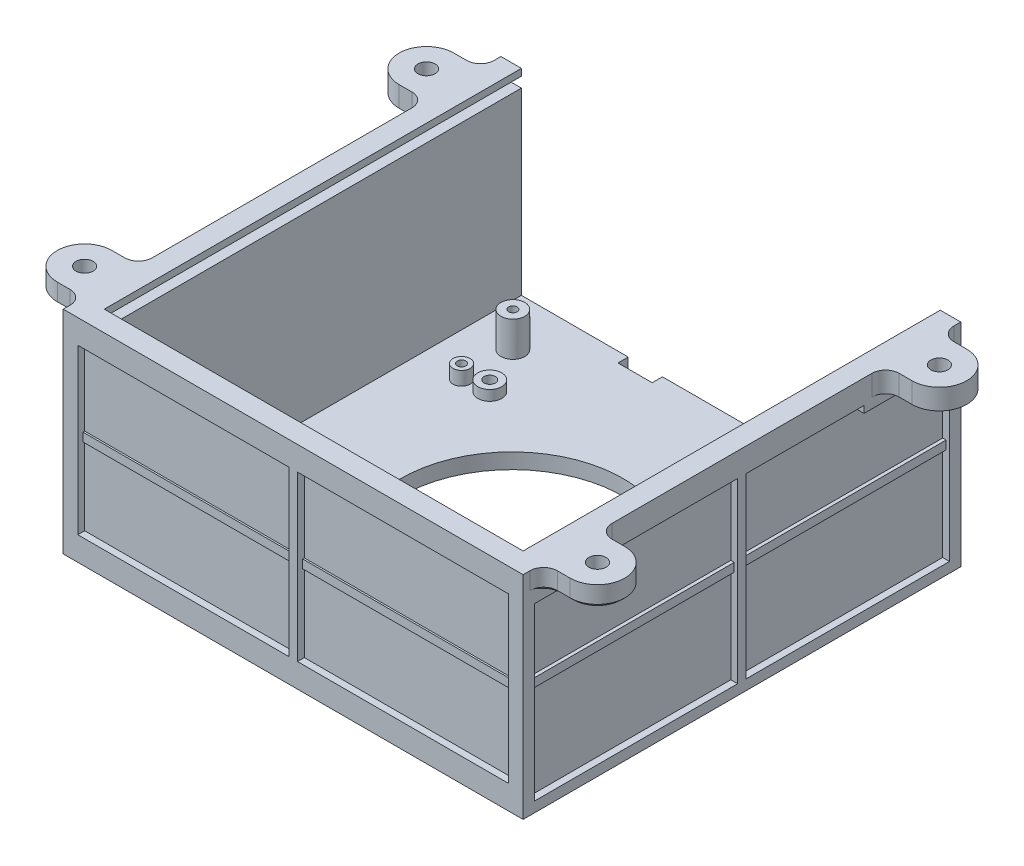
from build123d import *

# Parameters (mm, degrees)
EXTRUDE_2_DEPTH             = 2.5
EXTRUDE_2_DEPTH_BACK        = 2
SKETCH_1_W                  = 122.5
SKETCH_1_H                  = 128
SKETCH_1_R                  = 32.5
SKETCH_25_W                 = 6
SKETCH_25_H                 = 62
EXTRUDE_3_DEPTH             = 128
EXTRUDE_4_DEPTH             = 6
HOLE_WIZARD_M6_1_D          = 5
HOLE_WIZARD_M6_1_DEPTH      = 62
FILLET_3426_R               = 4
CHAMFER_5_SIZE              = 1
CUT_EXTRUDE_2_DEPTH         = 2
RIB_START                   = -1.25
RIB_21_OUTLINE_W            = 2
RIB_21_OUTLINE_H            = 52
RIB_21_DEPTH                = 2.5
RIB_19_OUTLINE_W            = 1
RIB_19_OUTLINE_H            = 59.462932812
RIB_19_DEPTH                = 2.5
MIRROR_START                = -1.25
MIRROR_24_COPY_1_SKETCH_W   = 1
MIRROR_24_COPY_1_SKETCH_H   = 59.462932812
MIRROR_24_COPY_1_DEPTH      = 2.5
SKETCH_93_R                 = 3.5
EXTRUDE_6713_DEPTH          = 10.2
SKETCH_97_R                 = 2.5
EXTRUDE_6822_DEPTH          = 4
SKETCH_101_W                = 1.25
SKETCH_101_H                = 10.2
HOLE_WIZARD_M3_5_AT_2_COUNT = 2
HOLE_WIZARD_M3_5_AT_2_PITCH = 75
HOLE_WIZARD_M3_5_AT_3_COUNT = 2
HOLE_WIZARD_M3_5_AT_3_PITCH = 15
HOLE_WIZARD_M3_5_AT_4_COUNT = 2
HOLE_WIZARD_M3_5_AT_4_PITCH = 81.39410298
HOLE_WIZARD_M3_5_AT_5_COUNT = 2
HOLE_WIZARD_M3_5_AT_5_PITCH = 109.658560997
HOLE_WIZARD_M3_5_AT_6_COUNT = 2
HOLE_WIZARD_M3_5_AT_6_PITCH = 134.536240471
HOLE_WIZARD_M3_5_AT_7_COUNT = 2
HOLE_WIZARD_M3_5_AT_7_PITCH = 100
HOLE_WIZARD_M3_5_AT_8_COUNT = 2
HOLE_WIZARD_M3_5_AT_8_PITCH = 90
SKETCH_75_R                 = 3.5
ADAPTER1_DEPTH              = 4
FILLET_7_R                  = 4
MIRROR_30_COPY_1_D          = 5
MIRROR_30_COPY_1_DEPTH      = 62
MIRROR_30_COPY_2_D          = 5
MIRROR_30_COPY_2_DEPTH      = 62
SKETCH_112_W                = 122.5
SKETCH_112_H                = 6
EXTRUDE_5_DEPTH             = 57.5
CUT_EXTRUDE_6_DEPTH         = 2
RIB_30_OUTLINE_W            = 2
RIB_30_OUTLINE_H            = 48
RIB_30_DEPTH                = 2.5
RIB_35_OUTLINE_W            = 61.75
RIB_35_OUTLINE_H            = 0.5
RIB_35_DEPTH                = 2.5
EXTRUDE_9_DEPTH             = 3
HOLE_WIZARD_M4_11_D         = 3.3
FILLET_13_R                 = 1
SKETCH_139_W                = 10
SKETCH_139_H                = 4.5
CUT_EXTRUDE_8_DEPTH         = 3
SKETCH_140_W                = 3
SKETCH_140_H                = 3
CUT_EXTRUDE_9_DEPTH         = 126
SKETCH_141_W                = 4
SKETCH_141_H                = 3.023131311
CUT_EXTRUDE_10_DEPTH        = 128.5
SKETCH_146_R                = 3.5
EXTRUDE_10_DEPTH            = 3
HOLE_WIZARD_M4_13_D         = 3.3


# Read off the part's stored shape, not the designer's step: 筋21, 筋19, 筋30, 筋35
with BuildPart() as part:
    # 草图1 → 凸台-拉伸2 (new, two sides: drawn at the far end of the back side and taken through both)
    with BuildSketch(Plane(origin=(0, 0, 0), x_dir=(1, 0, 0), z_dir=(0, 1, 0)).offset(-EXTRUDE_2_DEPTH_BACK)):
        with Locations((53.75, 46)):
            Rectangle(SKETCH_1_W, SKETCH_1_H)
        with Locations(Location((53.75, 46, 0), (0, 0, 270))):
            Circle(SKETCH_1_R, mode=Mode.SUBTRACT)
    extrude(amount=EXTRUDE_2_DEPTH + EXTRUDE_2_DEPTH_BACK)

    # 草图25 → 凸台-拉伸3 (add)
    with BuildSketch(Plane.XY.offset(18)):
        with Locations((-10.5, 29)):
            Rectangle(SKETCH_25_W, SKETCH_25_H)
        with Locations((118, 29)):
            Rectangle(SKETCH_25_W, SKETCH_25_H)
    extrude(amount=-EXTRUDE_3_DEPTH)

    # 草图67 → 凸台-拉伸4 (add)
    with BuildSketch(Plane(origin=(0, 60, 0), x_dir=(1, 0, 0), z_dir=(0, 1, 0))):
        with BuildLine():
            Line((120, -12), (128.75, -12))
            ThreePointArc((128.75, -12), (136.75, -4), (128.75, 4))
            Line((128.75, 4), (120, 4))
            Line((120, 4), (120, -12))
        make_face()
        with BuildLine():
            Line((120, 104), (120, 88))
            Line((120, 88), (128.75, 88))
            ThreePointArc((128.75, 88), (136.75, 96), (128.75, 104))
            Line((128.75, 104), (120, 104))
        make_face()
    extrude_4 = extrude(amount=-EXTRUDE_4_DEPTH)

    # M6 螺纹孔1
    with Locations(Plane(origin=(0, 60, 0), x_dir=(1, 0, 0), z_dir=(0, 1, 0))):
        with Locations((128.75, -4)):
            hole_wizard_m6_1 = Hole(HOLE_WIZARD_M6_1_D / 2, depth=HOLE_WIZARD_M6_1_DEPTH)

    # 镜向15: 凸台-拉伸4, M6 螺纹孔1 across plane
    add(extrude_4.mirror(Plane.ZY.offset(-53.75)))
    add(hole_wizard_m6_1.mirror(Plane.ZY.offset(-53.75)), mode=Mode.SUBTRACT)

    # Fillet 3426
    fillet_3426_edges = [part.edges().sort_by_distance(p)[0] for p in [
        (-13.5, 57, 12),
        (-13.5, 57, -4),
        (121, 57, 12),
        (121, 57, -4),
    ]]
    fillet(fillet_3426_edges, radius=FILLET_3426_R)

    # Chamfer 5
    # the kernel refuses this chamfer: 1 mm, written as the material it takes off along each edge
    with BuildSketch(Plane(origin=(-21.25, 54, 4), x_dir=(0, 0, 1), z_dir=(1, 0, 0))) as chamfer_5_piece_1:
        Polygon((8, -CHAMFER_5_SIZE), (8 - CHAMFER_5_SIZE, 0), (8, 0), align=None)
    revolve(axis=Axis((-21.25, 54, 4), (0, -1, 0)), revolution_arc=180, mode=Mode.SUBTRACT)
    with BuildSketch(Plane(origin=(-21.25, 54, -4), x_dir=(0, 0.9996219169112968, -0.027495876610586414), z_dir=(1, 0, 0)), Plane(origin=(-17.5, 54, 12), x_dir=(0, 0.9996219169112968, 0.02749587661058555), z_dir=(-1, 0, 0)), Plane(origin=(125, 54, 12), x_dir=(1.0146772736684423e-15, -0.0274958766105891, -0.9996219169112968), z_dir=(1, 0, 0)), Plane(origin=(128.75, 54, -4), x_dir=(0, -0.02749587661058907, 0.9996219169112965), z_dir=(-1, 0, 0))) as chamfer_5_piece_2:
        Polygon((CHAMFER_5_SIZE * 0.999621916911, CHAMFER_5_SIZE * 0.0274958766106), (-CHAMFER_5_SIZE * 0.0274958766106, CHAMFER_5_SIZE * 0.999621916911), (0, 0), align=None)
    extrude(amount=3.75, mode=Mode.SUBTRACT)
    with BuildSketch(Plane(origin=(-17.5, 54, -8), x_dir=(0.8001932156753524, 0, -0.5997422926450486), z_dir=(-0.5997422926450486, 0, -0.8001932156753524))) as chamfer_5_piece_3_section:
        Polygon((4, -CHAMFER_5_SIZE), (4 + CHAMFER_5_SIZE, 0), (4, 0), align=None)
    chamfer_5_piece_3 = revolve(axis=Axis((-17.5, 54, -8), (0, -1, 0)), revolution_arc=126.851442945, mode=Mode.PRIVATE)
    chamfer_5_piece_3 = split(chamfer_5_piece_3, bisect_by=Plane(origin=(-13.5, 54.366614844, -5.09711177), z_dir=(-1, 0, 0)), keep=Keep.TOP, mode=Mode.PRIVATE)
    add(chamfer_5_piece_3, mode=Mode.SUBTRACT)
    with BuildSketch(Plane(origin=(-17.5, 54, 16), x_dir=(0.8001932156753524, 0, 0.5997422926450486), z_dir=(-0.5997422926450486, 0, 0.8001932156753524))) as chamfer_5_piece_4_section:
        Polygon((4 + CHAMFER_5_SIZE, 0), (4, CHAMFER_5_SIZE), (4, 0), align=None)
    chamfer_5_piece_4 = revolve(axis=Axis((-17.5, 54, 16), (0, 1, 0)), revolution_arc=126.851442945, mode=Mode.PRIVATE)
    chamfer_5_piece_4 = split(chamfer_5_piece_4, bisect_by=Plane(origin=(-13.5, 54.366614887, 13.097112838), z_dir=(-1, 0, 0)), keep=Keep.TOP, mode=Mode.PRIVATE)
    add(chamfer_5_piece_4, mode=Mode.SUBTRACT)
    with BuildSketch(Plane(origin=(125, 54, 16), x_dir=(-0.8001932156753527, 0, 0.5997422926450482), z_dir=(0.5997422926450482, 0, 0.8001932156753527))) as chamfer_5_piece_5_section:
        Polygon((4 + CHAMFER_5_SIZE, 0), (4, -CHAMFER_5_SIZE), (4, 0), align=None)
    chamfer_5_piece_5 = revolve(axis=Axis((125, 54, 16), (0, -1, 0)), revolution_arc=126.851442945, mode=Mode.PRIVATE)
    chamfer_5_piece_5 = split(chamfer_5_piece_5, bisect_by=Plane(origin=(121, 54.366614844, 13.09711177), z_dir=(1, 0, 0)), keep=Keep.TOP, mode=Mode.PRIVATE)
    add(chamfer_5_piece_5, mode=Mode.SUBTRACT)
    with BuildSketch(Plane(origin=(125, 54, -8), x_dir=(-0.8001932156753527, 0, -0.5997422926450482), z_dir=(0.5997422926450482, 0, -0.8001932156753527))) as chamfer_5_piece_6_section:
        Polygon((4 + CHAMFER_5_SIZE, 0), (4, CHAMFER_5_SIZE), (4, 0), align=None)
    chamfer_5_piece_6 = revolve(axis=Axis((125, 54, -8), (0, 1, 0)), revolution_arc=126.851442945, mode=Mode.PRIVATE)
    chamfer_5_piece_6 = split(chamfer_5_piece_6, bisect_by=Plane(origin=(121, 54.366614844, -5.09711177), z_dir=(1, 0, 0)), keep=Keep.TOP, mode=Mode.PRIVATE)
    add(chamfer_5_piece_6, mode=Mode.SUBTRACT)
    with BuildSketch(Plane(origin=(128.75, 54, 4), x_dir=(0, 0, 1), z_dir=(-1, 0, 0))) as chamfer_5_piece_7:
        Polygon((8 - CHAMFER_5_SIZE, 0), (8, CHAMFER_5_SIZE), (8, 0), align=None)
    revolve(axis=Axis((128.75, 54, 4), (0, 1, 0)), revolution_arc=180, mode=Mode.SUBTRACT)

    # 草图79 → 切除-拉伸2 (cut)
    with BuildSketch(Plane(origin=(121, 0, 0), x_dir=(0, 0, -1), z_dir=(1, 0, 0))):
        Polygon((106.712932812, 1), (-14.712932812, 1), (-14.712932812, 51), (10.287067188, 51), (10.287067188, 53), (81.712932812, 53), (81.712932812, 51), (106.712932812, 51), align=None)
    cut_extrude_2 = extrude(amount=-CUT_EXTRUDE_2_DEPTH, mode=Mode.SUBTRACT)

    # 筋21 outline → 筋21 (add)
    with BuildSketch(Plane.XY.offset(-46).offset(RIB_START)):
        with Locations((120, 27)):
            Rectangle(RIB_21_OUTLINE_W, RIB_21_OUTLINE_H)
    rib_21 = extrude(amount=RIB_21_DEPTH)

    # 筋19 outline → 筋19 (add)
    with BuildSketch(Plane(origin=(0, 30, 0), x_dir=(1, 0, 0), z_dir=(0, 1, 0)).offset(RIB_START)):
        with Locations((119.5, 15.018533594)):
            Rectangle(RIB_19_OUTLINE_W, RIB_19_OUTLINE_H)
    rib_19 = extrude(amount=RIB_19_DEPTH)

    # 镜向23: 筋19 across plane
    add(rib_19.mirror(Plane.XY.offset(-46)))

    # 镜向24: 切除-拉伸2, 筋21, 筋19 across plane
    add(cut_extrude_2.mirror(Plane.ZY.offset(-53.75)), mode=Mode.SUBTRACT)
    add(rib_21.mirror(Plane.ZY.offset(-53.75)))
    add(rib_19.mirror(Plane.ZY.offset(-53.75)))

    # 镜向24 copy 1 sketch → 镜向24 copy 1 (add)
    with BuildSketch(Plane(origin=(107.5, 30, -92), x_dir=(-1, 0, 0), z_dir=(0, 1, 0)).offset(MIRROR_START)):
        with Locations((119.5, 15.018533594)):
            Rectangle(MIRROR_24_COPY_1_SKETCH_W, MIRROR_24_COPY_1_SKETCH_H)
    extrude(amount=MIRROR_24_COPY_1_DEPTH)

    # 草图93 → Extrude 6713 (add)
    with BuildSketch(Plane(origin=(0, 2.5, 0), x_dir=(1, 0, 0), z_dir=(0, 1, 0))):
        with Locations(Location((5, 95, 0), (0, 0, 90))):
            Circle(SKETCH_93_R)
        with Locations(Location((105, 95, 0), (0, 0, 90))):
            Circle(SKETCH_93_R)
        with Locations(Location((5, 5, 0), (0, 0, 90))):
            Circle(SKETCH_93_R)
        with Locations(Location((105, 5, 0), (0, 0, 90))):
            Circle(SKETCH_93_R)
    extrude(amount=EXTRUDE_6713_DEPTH)

    # 草图97 → Extrude 6822 (add)
    with BuildSketch(Plane(origin=(0, 2.5, 0), x_dir=(1, 0, 0), z_dir=(0, 1, 0))):
        with Locations(Location((5, 80, 0), (0, 0, 90))):
            Circle(SKETCH_97_R)
        with Locations(Location((5, 20, 0), (0, 0, 90))):
            Circle(SKETCH_97_R)
        with Locations(Location((85, 80, 0), (0, 0, 90))):
            Circle(SKETCH_97_R)
        with Locations(Location((85, 20, 0), (0, 0, 90))):
            Circle(SKETCH_97_R)
    extrude(amount=EXTRUDE_6822_DEPTH)

    # 草图101 → M3 螺纹孔5 (revolve, cut)
    with BuildSketch(Plane(origin=(5, 2.5, -95), x_dir=(0, 0, -1), z_dir=(1, 0, 0))):
        with Locations((0.625, 5.1)):
            Rectangle(SKETCH_101_W, SKETCH_101_H)
    hole_wizard_m3_5 = revolve(axis=Axis((5, -3.85, -95), (0, 1, 0)), mode=Mode.SUBTRACT)

    # M3 螺纹孔5 at 2: M3 螺纹孔5 ×2
    with Locations(*[(0, 0, i * HOLE_WIZARD_M3_5_AT_2_PITCH) for i in range(1, HOLE_WIZARD_M3_5_AT_2_COUNT)]):
        add(hole_wizard_m3_5, mode=Mode.SUBTRACT)

    # M3 螺纹孔5 at 3: M3 螺纹孔5 ×2
    with Locations(*[(0, 0, i * HOLE_WIZARD_M3_5_AT_3_PITCH) for i in range(1, HOLE_WIZARD_M3_5_AT_3_COUNT)]):
        add(hole_wizard_m3_5, mode=Mode.SUBTRACT)

    # M3 螺纹孔5 at 4: M3 螺纹孔5 ×2
    with Locations(*[Vector(0.9828721869343219, 0, 0.18428853505018553) * (i * HOLE_WIZARD_M3_5_AT_4_PITCH) for i in range(1, HOLE_WIZARD_M3_5_AT_4_COUNT)]):
        add(hole_wizard_m3_5, mode=Mode.SUBTRACT)

    # M3 螺纹孔5 at 5: M3 螺纹孔5 ×2
    with Locations(*[Vector(0.729537204140085, 0, 0.6839411288813299) * (i * HOLE_WIZARD_M3_5_AT_5_PITCH) for i in range(1, HOLE_WIZARD_M3_5_AT_5_COUNT)]):
        add(hole_wizard_m3_5, mode=Mode.SUBTRACT)

    # M3 螺纹孔5 at 6: M3 螺纹孔5 ×2
    with Locations(*[Vector(0.7432941462471663, 0, 0.6689647316224497) * (i * HOLE_WIZARD_M3_5_AT_6_PITCH) for i in range(1, HOLE_WIZARD_M3_5_AT_6_COUNT)]):
        add(hole_wizard_m3_5, mode=Mode.SUBTRACT)

    # M3 螺纹孔5 at 7: M3 螺纹孔5 ×2
    with Locations(*[(i * HOLE_WIZARD_M3_5_AT_7_PITCH, 0, 0) for i in range(1, HOLE_WIZARD_M3_5_AT_7_COUNT)]):
        add(hole_wizard_m3_5, mode=Mode.SUBTRACT)

    # M3 螺纹孔5 at 8: M3 螺纹孔5 ×2
    with Locations(*[(0, 0, i * HOLE_WIZARD_M3_5_AT_8_PITCH) for i in range(1, HOLE_WIZARD_M3_5_AT_8_COUNT)]):
        add(hole_wizard_m3_5, mode=Mode.SUBTRACT)

    # 草图75 → 定位adapter1 (add)
    with BuildSketch(Plane(origin=(0, -2, 0), x_dir=(-1, 0, 0), z_dir=(0, -1, 0))):
        with Locations((-14.75, 78.5)):
            Circle(SKETCH_75_R)
        with Locations((-92.75, 78.5)):
            Circle(SKETCH_75_R)
        with Locations((-92.75, 13.5)):
            Circle(SKETCH_75_R)
        with Locations((-14.75, 13.5)):
            Circle(SKETCH_75_R)
    extrude(amount=-ADAPTER1_DEPTH)

    # 镜向27: M6 螺纹孔1 across plane
    add(hole_wizard_m6_1.mirror(Plane.XY.offset(-46)), mode=Mode.SUBTRACT)

    # 圆角7
    fillet_7_edges = [part.edges().sort_by_distance(p)[0] for p in [
        (-13.5, 57, -104),
        (-13.5, 57, -88),
        (121, 57, -104),
        (121, 57, -88),
    ]]
    fillet(fillet_7_edges, radius=FILLET_7_R)

    # 镜向30 copy 1
    with Locations(Plane(origin=(107.5, 60, -92), x_dir=(-1, 0, 0), z_dir=(0, 1, 0))):
        with Locations((128.75, -4)):
            Hole(MIRROR_30_COPY_1_D / 2, depth=MIRROR_30_COPY_1_DEPTH)

    # 镜向30 copy 2
    with Locations(Plane(origin=(107.5, 60, 0), x_dir=(-1, 0, 0), z_dir=(0, 1, 0))):
        with Locations((128.75, 4)):
            Hole(MIRROR_30_COPY_2_D / 2, depth=MIRROR_30_COPY_2_DEPTH)

    # 草图112 → 凸台-拉伸5 (add)
    with BuildSketch(Plane(origin=(0, 2.5, 0), x_dir=(1, 0, 0), z_dir=(0, 1, 0))):
        with Locations((53.75, -15)):
            Rectangle(SKETCH_112_W, SKETCH_112_H)
    extrude(amount=EXTRUDE_5_DEPTH)

    # 草图124 → 切除-拉伸6 (cut)
    with BuildSketch(Plane.XY.offset(18)):
        Polygon((116.75, 53), (88.75, 53), (18.75, 53), (-9.25, 53), (-9.25, 5), (116.75, 5), align=None)
    extrude(amount=-CUT_EXTRUDE_6_DEPTH, mode=Mode.SUBTRACT)

    # 筋30 outline → 筋30 (add)
    with BuildSketch(Plane.ZY.offset(-53.75).offset(RIB_START)):
        with Locations((17, 29)):
            Rectangle(RIB_30_OUTLINE_W, RIB_30_OUTLINE_H)
    extrude(amount=RIB_30_DEPTH)

    # 筋35 outline → 筋35 (add)
    with BuildSketch(Plane(origin=(0, 29, 0), x_dir=(1, 0, 0), z_dir=(0, 1, 0)).offset(RIB_START)):
        with Locations((21.625, -16.25)):
            Rectangle(RIB_35_OUTLINE_W, RIB_35_OUTLINE_H)
    rib_35 = extrude(amount=RIB_35_DEPTH)

    # 镜向35: 筋35 across plane
    add(rib_35.mirror(Plane.ZY.offset(-53.75)))

    # 草图135 → 凸台-拉伸9 (add)
    with BuildSketch(Plane(origin=(0, 0, -104), x_dir=(-1, 0, 0), z_dir=(0, 0, -1))):
        with BuildLine():
            Line((-83.75, 2.5), (-73.75, 2.5))
            Line((-73.75, 2.5), (-73.75, -5.5))
            ThreePointArc((-73.75, -5.5), (-78.75, -10.5), (-83.75, -5.5))
            Line((-83.75, -5.5), (-83.75, 2.5))
        make_face()
        with BuildLine():
            Line((-33.75, 2.5), (-33.75, -5.5))
            ThreePointArc((-33.75, -5.5), (-28.75, -10.5), (-23.75, -5.5))
            Line((-23.75, -5.5), (-23.75, 2.5))
            Line((-23.75, 2.5), (-33.75, 2.5))
        make_face()
    extrude(amount=EXTRUDE_9_DEPTH)

    # M4 螺纹孔11 (through all)
    with Locations(Plane(origin=(0, 0, -107), x_dir=(-1, 0, 0), z_dir=(0, 0, -1))):
        with Locations((-78.75, -5.5)):
            hole_wizard_m4_11 = Hole(HOLE_WIZARD_M4_11_D / 2)

    # 镜向46: M4 螺纹孔11 across plane
    add(hole_wizard_m4_11.mirror(Plane.ZY.offset(-53.75)), mode=Mode.SUBTRACT)

    # 圆角13
    fillet_13_edges = [part.edges().sort_by_distance(p)[0] for p in [
        (83.75, -3.75, -104),
        (78.75, -10.5, -104),
        (73.75, -3.75, -104),
        (33.75, -3.75, -104),
        (28.75, -10.5, -104),
        (23.75, -3.75, -104),
    ]]
    fillet(fillet_13_edges, radius=FILLET_13_R)

    # 草图139 → 切除-拉伸8 (cut)
    with BuildSketch(Plane(origin=(0, 0, -110), x_dir=(-1, 0, 0), z_dir=(0, 0, -1))):
        with Locations((-78.75, 0.25)):
            Rectangle(SKETCH_139_W, SKETCH_139_H)
    cut_extrude_8 = extrude(amount=-CUT_EXTRUDE_8_DEPTH, mode=Mode.SUBTRACT)

    # 镜向47: 切除-拉伸8 across plane
    add(cut_extrude_8.mirror(Plane.ZY.offset(-53.75)), mode=Mode.SUBTRACT)

    # 草图140 → 切除-拉伸9 (cut)
    with BuildSketch(Plane(origin=(0, 0, -110), x_dir=(-1, 0, 0), z_dir=(0, 0, -1))):
        with Locations((-116.5, 56.5)):
            Rectangle(SKETCH_140_W, SKETCH_140_H)
    cut_extrude_9 = extrude(amount=-CUT_EXTRUDE_9_DEPTH, mode=Mode.SUBTRACT)

    # 草图141 → 切除-拉伸10 (cut)
    with BuildSketch(Plane.ZY.offset(-118)):
        with Locations((14, 56.511565656)):
            Rectangle(SKETCH_141_W, SKETCH_141_H)
    extrude(amount=CUT_EXTRUDE_10_DEPTH, mode=Mode.SUBTRACT)

    # 镜向48: 切除-拉伸9 across plane
    add(cut_extrude_9.mirror(Plane.ZY.offset(-53.75)), mode=Mode.SUBTRACT)

    # 草图146 → 凸台-拉伸10 (add)
    with BuildSketch(Plane(origin=(0, 2.5, 0), x_dir=(1, 0, 0), z_dir=(0, 1, 0))):
        with Locations(Location((12.25, 81, 0), (0, 0, 90))):
            Circle(SKETCH_146_R)
        with Locations(Location((12.25, 11, 0), (0, 0, 90))):
            Circle(SKETCH_146_R)
        with Locations(Location((95.25, 11, 0), (0, 0, 90))):
            Circle(SKETCH_146_R)
        with Locations(Location((95.25, 81, 0), (0, 0, 90))):
            Circle(SKETCH_146_R)
    extrude(amount=EXTRUDE_10_DEPTH)

    # M4 螺纹孔13 (through all)
    with Locations(Plane(origin=(0, -2, 0), x_dir=(-1, 0, 0), z_dir=(0, -1, 0))):
        with Locations((-12.25, 11), (-12.25, 81), (-95.25, 81), (-95.25, 11)):
            Hole(HOLE_WIZARD_M4_13_D / 2)


solid = part.part
